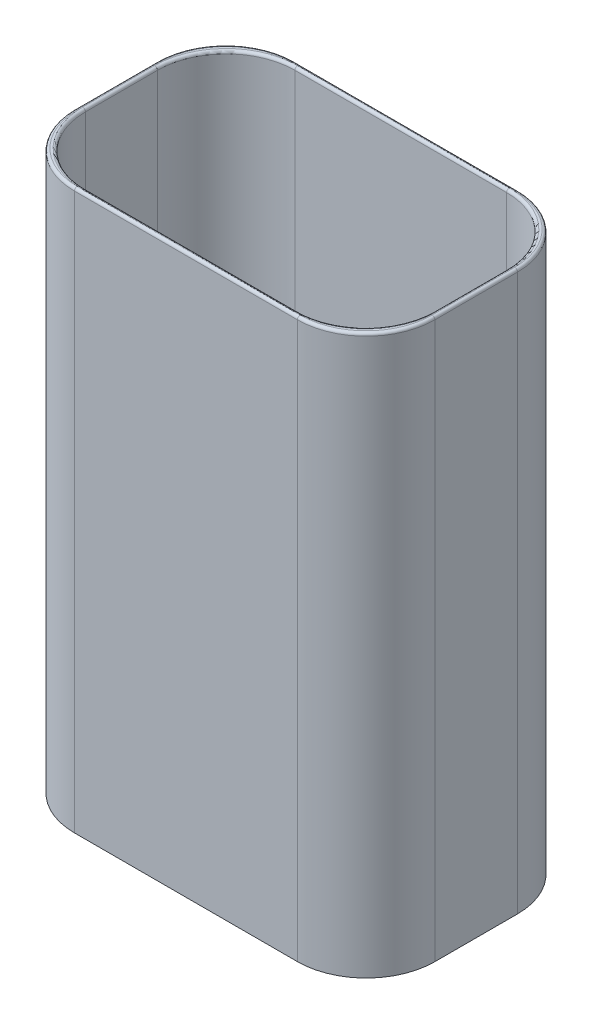
from build123d import *

# Parameters (mm, degrees)
SKETCH1_W           = 127
SKETCH1_H           = 76.2
BOSS_EXTRUDE1_DEPTH = 2
BOSS_EXTRUDE2_DEPTH = 203.2
FILLET2_R           = 25
FILLET3_R           = 15
FILLET4_R           = 1


with BuildPart() as part:
    # Sketch1 → Boss-Extrude1 (new body)
    with BuildSketch(Plane(origin=(0, 0, 0), x_dir=(1, 0, 0), z_dir=(0, 1, 0))):
        with Locations((32.767173068, 3.871122995)):
            Rectangle(SKETCH1_W, SKETCH1_H)
        Polygon((96.267173068, -34.228877005), (98.330615884, -36.163354646), (-32.796269749, -36.163354646), (-32.796269749, 43.905600635), (-30.732826932, 41.971122995), (-30.732826932, -34.228877005), align=None)
        Polygon((96.267173068, 41.971122995), (96.267173068, -34.228877005), (98.330615884, -36.163354646), (98.330615884, 43.905600635), align=None)
        Polygon((-30.732826932, 41.971122995), (96.267173068, 41.971122995), (98.330615884, 43.905600635), (-32.796269749, 43.905600635), align=None)
    extrude(amount=BOSS_EXTRUDE1_DEPTH)

    # Sketch1<3> → Boss-Extrude2 (add)
    with BuildSketch(Plane(origin=(0, 0, 0), x_dir=(1, 0, 0), z_dir=(0, 1, 0))):
        Polygon((96.267173068, 41.971122995), (96.267173068, -34.228877005), (98.330615884, -36.163354646), (98.330615884, 43.905600635), align=None)
        Polygon((-30.732826932, 41.971122995), (96.267173068, 41.971122995), (98.330615884, 43.905600635), (-32.796269749, 43.905600635), align=None)
        Polygon((96.267173068, -34.228877005), (98.330615884, -36.163354646), (-32.796269749, -36.163354646), (-32.796269749, 43.905600635), (-30.732826932, 41.971122995), (-30.732826932, -34.228877005), align=None)
    extrude(amount=BOSS_EXTRUDE2_DEPTH)

    # Fillet2
    fillet2_edges = [part.edges().sort_by_distance(p)[0] for p in [
        (96.267173068, 102.6, -41.971122995),
        (96.267173068, 102.6, 34.228877005),
        (-30.732826932, 102.6, 34.228877005),
        (-30.732826932, 102.6, -41.971122995),
        (98.330615884, 101.6, 36.163354646),
        (-32.796269749, 101.6, 36.163354646),
        (-32.796269749, 101.6, -43.905600635),
        (98.330615884, 101.6, -43.905600635),
    ]]
    fillet(fillet2_edges, radius=FILLET2_R)

    # Fillet3
    fillet3_edges = [part.edges().sort_by_distance(p)[0] for p in [
        (32.767173068, 2, -41.971122995),
        (32.767173068, 2, 34.228877005),
        (96.267173068, 2, -3.871122995),
        (-30.732826932, 2, -3.871122995),
        (88.944842597, 2, -34.648792524),
        (88.944842597, 2, 26.906546535),
        (-23.410496462, 2, 26.906546535),
        (-23.410496462, 2, -34.648792524),
    ]]
    fillet(fillet3_edges, radius=FILLET3_R)

    # Fillet4
    # the kernel refuses this fillet: 1 mm, written as the material it takes off along each edge
    with BuildSketch(Plane(origin=(-32.796269749, 203.2, 11.163354646), x_dir=(1, 0, 0), z_dir=(0, 0, -1))) as fillet4_piece_1:
        with BuildLine():
            CenterArc((FILLET4_R, FILLET4_R), FILLET4_R, 180, 90)
            Line((0, FILLET4_R), (0, 0))
            Line((0, 0), (FILLET4_R, 0))
        make_face()
    extrude(amount=30.068955281, mode=Mode.SUBTRACT)
    with BuildSketch(Plane(origin=(73.330615884, 203.2, -43.905600635), x_dir=(0, 0, 1), z_dir=(-1, 0, 0))) as fillet4_piece_2:
        with BuildLine():
            CenterArc((FILLET4_R, -FILLET4_R), FILLET4_R, 90, 90)
            Line((0, -FILLET4_R), (0, 0))
            Line((0, 0), (FILLET4_R, 0))
        make_face()
    extrude(amount=81.126885633, mode=Mode.SUBTRACT)
    with BuildSketch(Plane(origin=(73.330615884, 203.2, 36.163354646), x_dir=(0, 0, -1), z_dir=(-1, 0, 0))) as fillet4_piece_3:
        with BuildLine():
            CenterArc((FILLET4_R, FILLET4_R), FILLET4_R, 180, 90)
            Line((0, FILLET4_R), (0, 0))
            Line((0, 0), (FILLET4_R, 0))
        make_face()
    extrude(amount=81.126885633, mode=Mode.SUBTRACT)
    with BuildSketch(Plane(origin=(98.330615884, 203.2, 11.163354646), x_dir=(-1, 0, 0), z_dir=(0, 0, -1))) as fillet4_piece_4:
        with BuildLine():
            CenterArc((FILLET4_R, -FILLET4_R), FILLET4_R, 90, 90)
            Line((0, -FILLET4_R), (0, 0))
            Line((0, 0), (FILLET4_R, 0))
        make_face()
    extrude(amount=30.068955281, mode=Mode.SUBTRACT)
    with BuildSketch(Plane(origin=(-5.732826932, 203.2, -41.971122995), x_dir=(0, 0, -1), z_dir=(1, 0, 0))) as fillet4_piece_5:
        with BuildLine():
            CenterArc((FILLET4_R, -FILLET4_R), FILLET4_R, 90, 90)
            Line((0, -FILLET4_R), (0, 0))
            Line((0, 0), (FILLET4_R, 0))
        make_face()
    extrude(amount=77, mode=Mode.SUBTRACT)
    with BuildSketch(Plane(origin=(-30.732826932, 203.2, -16.971122995), x_dir=(-1, 0, 0), z_dir=(0, 0, 1)), Plane(origin=(96.267173068, 203.2, -16.971122995), x_dir=(0, -1, 0), z_dir=(0, 0, 1))) as fillet4_piece_6:
        with BuildLine():
            CenterArc((FILLET4_R, FILLET4_R), FILLET4_R, 180, 90)
            Line((0, FILLET4_R), (0, 0))
            Line((0, 0), (FILLET4_R, 0))
        make_face()
    extrude(amount=26.2, mode=Mode.SUBTRACT)
    with BuildSketch(Plane(origin=(-5.732826932, 203.2, 34.228877005), x_dir=(0, 0, 1), z_dir=(1, 0, 0))) as fillet4_piece_7:
        with BuildLine():
            CenterArc((FILLET4_R, FILLET4_R), FILLET4_R, 180, 90)
            Line((0, FILLET4_R), (0, 0))
            Line((0, 0), (FILLET4_R, 0))
        make_face()
    extrude(amount=77, mode=Mode.SUBTRACT)
    with BuildSketch(Plane(origin=(-5.732826932, 203.2, -16.971122995), x_dir=(0, 0, -1), z_dir=(1, 0, 0))) as fillet4_piece_8:
        with BuildLine():
            CenterArc((25 + FILLET4_R, -FILLET4_R), FILLET4_R, 90, 90)
            Line((25, -FILLET4_R), (25, 0))
            Line((25, 0), (25 + FILLET4_R, 0))
        make_face()
    revolve(axis=Axis((-5.732826932, 203.2, -16.971122995), (0, 1, 0)), revolution_arc=90, mode=Mode.SUBTRACT)
    with BuildSketch(Plane(origin=(-5.732826932, 203.2, 9.228877005), x_dir=(-1, 0, 0), z_dir=(0, 0, -1))) as fillet4_piece_9:
        with BuildLine():
            CenterArc((25 + FILLET4_R, -FILLET4_R), FILLET4_R, 90, 90)
            Line((25, -FILLET4_R), (25, 0))
            Line((25, 0), (25 + FILLET4_R, 0))
        make_face()
    revolve(axis=Axis((-5.732826932, 203.2, 9.228877005), (0, 1, 0)), revolution_arc=90, mode=Mode.SUBTRACT)
    with BuildSketch(Plane(origin=(71.267173068, 203.2, 9.228877005), x_dir=(0, 0, 1), z_dir=(-1, 0, 0))) as fillet4_piece_10:
        with BuildLine():
            CenterArc((25 + FILLET4_R, -FILLET4_R), FILLET4_R, 90, 90)
            Line((25, -FILLET4_R), (25, 0))
            Line((25, 0), (25 + FILLET4_R, 0))
        make_face()
    revolve(axis=Axis((71.267173068, 203.2, 9.228877005), (0, 1, 0)), revolution_arc=90, mode=Mode.SUBTRACT)
    with BuildSketch(Plane(origin=(71.267173068, 203.2, -16.971122995), x_dir=(0, 0, -1), z_dir=(-1, 0, 0))) as fillet4_piece_11:
        with BuildLine():
            CenterArc((25 + FILLET4_R, FILLET4_R), FILLET4_R, 180, 90)
            Line((25 + FILLET4_R, 0), (25, 0))
            Line((25, 0), (25, FILLET4_R))
        make_face()
    revolve(axis=Axis((71.267173068, 203.2, -16.971122995), (0, -1, 0)), revolution_arc=90, mode=Mode.SUBTRACT)
    with BuildSketch(Plane(origin=(73.330615884, 203.2, -18.905600635), x_dir=(1, 0, 0), z_dir=(0, 0, 1))) as fillet4_piece_12:
        with BuildLine():
            CenterArc((25 - FILLET4_R, -FILLET4_R), FILLET4_R, 0, 90)
            Line((25, -FILLET4_R), (25, 0))
            Line((25, 0), (25 - FILLET4_R, 0))
        make_face()
    revolve(axis=Axis((73.330615884, 203.2, -18.905600635), (0, 1, 0)), revolution_arc=90, mode=Mode.SUBTRACT)
    with BuildSketch(Plane(origin=(73.330615884, 203.2, 11.163354646), x_dir=(1, 0, 0), z_dir=(0, 0, -1))) as fillet4_piece_13:
        with BuildLine():
            CenterArc((25 - FILLET4_R, FILLET4_R), FILLET4_R, 270, 90)
            Line((25, FILLET4_R), (25, 0))
            Line((25, 0), (25 - FILLET4_R, 0))
        make_face()
    revolve(axis=Axis((73.330615884, 203.2, 11.163354646), (0, -1, 0)), revolution_arc=90, mode=Mode.SUBTRACT)
    with BuildSketch(Plane(origin=(-7.796269749, 203.2, 11.163354646), x_dir=(-1, 0, 0), z_dir=(0, 0, -1))) as fillet4_piece_14:
        with BuildLine():
            CenterArc((25 - FILLET4_R, -FILLET4_R), FILLET4_R, 0, 90)
            Line((25, -FILLET4_R), (25, 0))
            Line((25, 0), (25 - FILLET4_R, 0))
        make_face()
    revolve(axis=Axis((-7.796269749, 203.2, 11.163354646), (0, 1, 0)), revolution_arc=90, mode=Mode.SUBTRACT)
    with BuildSketch(Plane(origin=(-7.796269749, 203.2, -18.905600635), x_dir=(0, 0, -1), z_dir=(1, 0, 0))) as fillet4_piece_15:
        with BuildLine():
            CenterArc((25 - FILLET4_R, -FILLET4_R), FILLET4_R, 0, 90)
            Line((25, -FILLET4_R), (25, 0))
            Line((25, 0), (25 - FILLET4_R, 0))
        make_face()
    revolve(axis=Axis((-7.796269749, 203.2, -18.905600635), (0, 1, 0)), revolution_arc=90, mode=Mode.SUBTRACT)


solid = part.part
